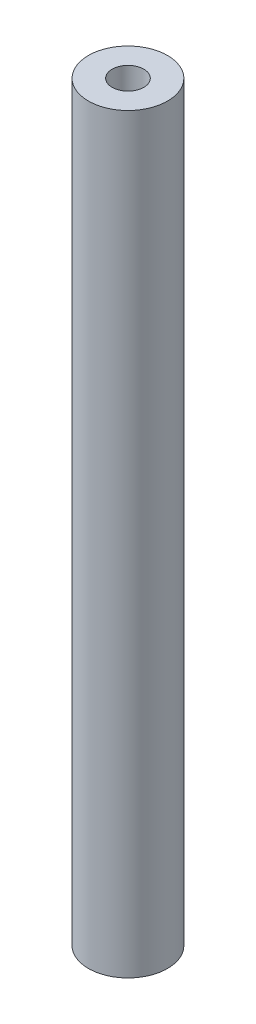
from build123d import *

# Parameters (mm, degrees)
SKETCH1_R           = 5
BOSS_EXTRUDE1_DEPTH = 103
SKETCH5_W           = 1
SKETCH5_H           = 4
SKETCH6_R           = 5
CUT_EXTRUDE1_DEPTH  = 20


with BuildPart() as part:
    # Sketch1 → Boss-Extrude1 (new body)
    with BuildSketch(Plane(origin=(0, 0, 0), x_dir=(1, 0, 0), z_dir=(0, 1, 0))):
        Circle(SKETCH1_R)
    extrude(amount=BOSS_EXTRUDE1_DEPTH)

    # Sketch4 → Ø4.0mm Dowel Hole1 (revolve, cut)
    with BuildSketch(Plane(origin=(0, 103, 0), x_dir=(0, 0, 1), z_dir=(1, 0, 0))):
        Polygon((0, 0), (0, 19.201721238), (2, 18), (2, 0.025), (2.025, 0), align=None)
    f_4_0mm_dowel_hole1 = revolve(axis=Axis((0, 109.35, 0), (0, -1, 0)), mode=Mode.SUBTRACT)

    # Mirror1: Ø4.0mm Dowel Hole1 across plane
    add(f_4_0mm_dowel_hole1.mirror(Plane.ZX.offset(51.5)), mode=Mode.SUBTRACT)

    # Sketch5 → Cut-Revolve2 (revolve, cut)
    with BuildSketch(Plane.XY):
        with Locations((-4.5, 101)):
            Rectangle(SKETCH5_W, SKETCH5_H)
        with Locations((-4.5, 2)):
            Rectangle(SKETCH5_W, SKETCH5_H)
    revolve(axis=Axis((0, 103, 0), (0, -1, 0)), mode=Mode.SUBTRACT)

    # Sketch6 → Cut-Extrude1 (cut)
    with BuildSketch(Plane(origin=(0, 99, 0), x_dir=(1, 0, 0), z_dir=(0, 1, 0))):
        Circle(SKETCH6_R)
    cut_extrude1 = extrude(amount=CUT_EXTRUDE1_DEPTH, mode=Mode.SUBTRACT)

    # Mirror3: Cut-Extrude1 across plane
    add(cut_extrude1.mirror(Plane.ZX.offset(51.5)), mode=Mode.SUBTRACT)


solid = part.part
